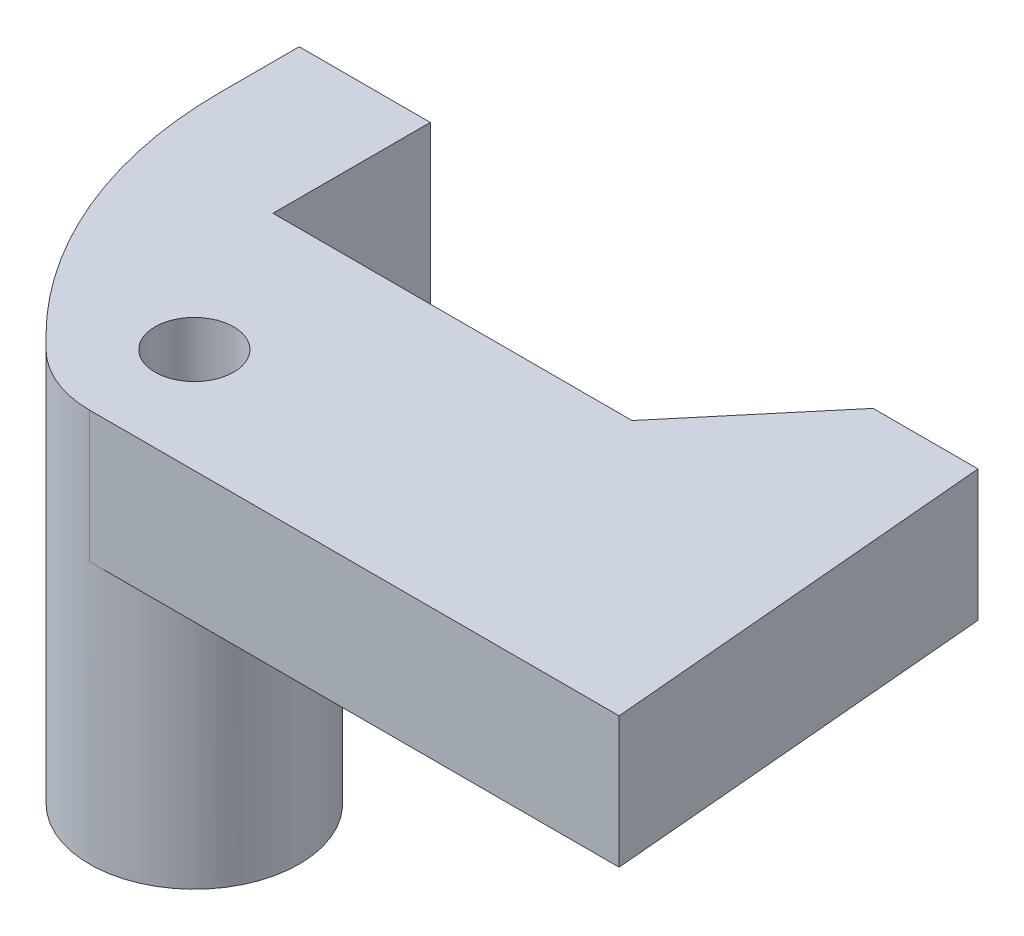
from build123d import *

# Parameters (mm, degrees)
SKETCH1_R           = 1.5
BOSS_EXTRUDE1_DEPTH = 5
BOSS_EXTRUDE2_START = 10
SKETCH2_R           = 1.5
BOSS_EXTRUDE2_DEPTH = 10


with BuildPart() as part:
    # Sketch1 → Boss-Extrude1 (new body)
    with BuildSketch(Plane(origin=(0, 0, 0), x_dir=(1, 0, 0), z_dir=(0, 1, 0))):
        with BuildLine():
            Line((-11, 13), (-11, 16))
            Line((-11, 16), (-6, 16))
            Line((-6, 16), (-6, 10))
            Line((-6, 10), (7.692171891, 10))
            Line((7.692171891, 10), (11.887670047, 15))
            Line((11.887670047, 15), (15.887670047, 15))
            Line((15.887670047, 15), (17.2, 0))
            Line((17.2, 0), (-3, 0))
            ThreePointArc((-3, 0), (-4.530733729, 0.30448187), (-5.828427125, 1.171572875))
            Line((-5.828427125, 1.171572875), (-6.292893219, 1.636038969))
            ThreePointArc((-6.292893219, 1.636038969), (-9.776662805, 6.849868608), (-11, 13))
        make_face()
        with Locations((-3, 4)):
            Circle(SKETCH1_R, mode=Mode.SUBTRACT)
    extrude(amount=BOSS_EXTRUDE1_DEPTH)

    # Sketch2 → Boss-Extrude2 (add)
    with BuildSketch(Plane.XZ.offset(BOSS_EXTRUDE2_START)):
        with BuildLine():
            Line((-5.828427125, -1.171572875), (-6.292893219, -1.636038969))
            ThreePointArc((-6.292893219, -1.636038969), (-9.776662805, -6.849868608), (-11, -13))
            Line((-11, -13), (-11, -16))
            Line((-11, -16), (-6, -16))
            Line((-6, -16), (-6, -8))
            Line((-6, -8), (-3, -8))
            ThreePointArc((-3, -8), (1, -4), (-3, 0))
            ThreePointArc((-3, 0), (-4.530733729, -0.30448187), (-5.828427125, -1.171572875))
        make_face()
        with Locations((-3, -4)):
            Circle(SKETCH2_R, mode=Mode.SUBTRACT)
    extrude(amount=-BOSS_EXTRUDE2_DEPTH)


solid = part.part
